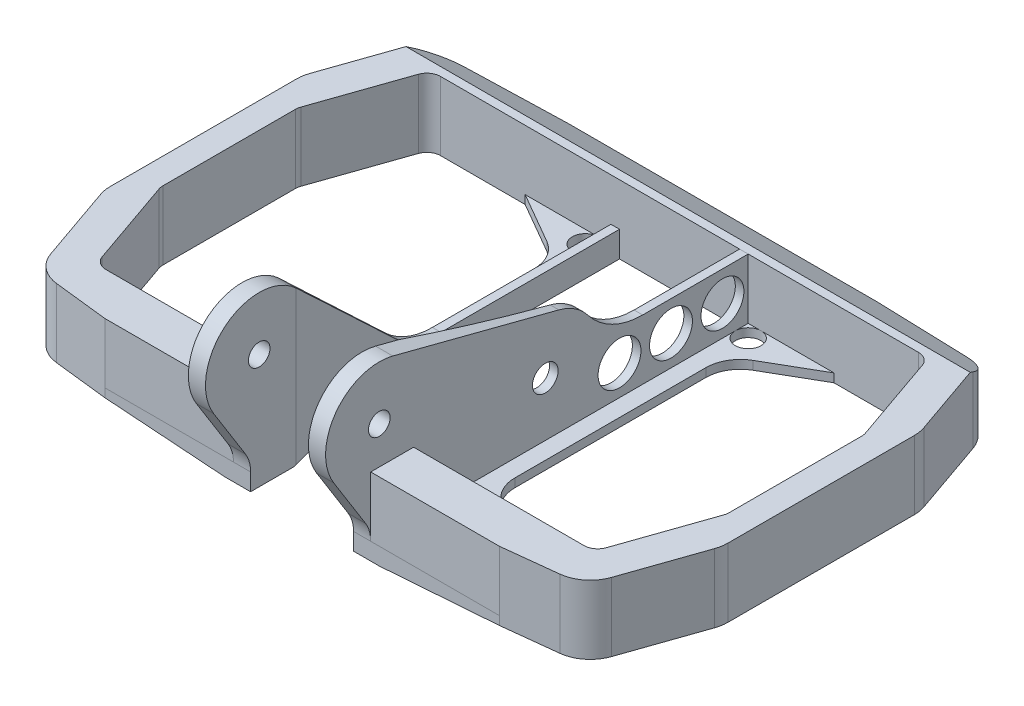
from build123d import *

# Parameters (mm, degrees)
BOSS_EXTRUDE1_DEPTH      = 203.2
BOSS_EXTRUDE1_2_DEPTH    = 203.2
CUT_EXTRUDE2_DEPTH       = 249.300427909
CUT_EXTRUDE2_DEPTH_BACK  = 249.300427909
SKETCH4_R                = 4
CUT_EXTRUDE4_DEPTH       = 18.542
CUT_EXTRUDE4_DEPTH_BACK  = 86.36
SKETCH7_R                = 4
CUT_EXTRUDE3_DEPTH       = 232.284287726
CUT_EXTRUDE3_DEPTH_BACK  = 232.284287726
SKETCH8_R                = 4.7625
CUT_EXTRUDE5_DEPTH       = 210.909001948
FILLET1_R                = 25.4
FILLET2_R                = 25.4
CUT_EXTRUDE7_DEPTH       = 213.960346307
CUT_EXTRUDE7_DEPTH_BACK  = 213.960346307
CUT_EXTRUDE8_DEPTH       = 198.3731504
CUT_EXTRUDE8_DEPTH_BACK  = 198.3731504
BOSS_EXTRUDE2_DEPTH      = 25.4
SKETCH20_W               = 146.05
SKETCH20_H               = 15.875
SKETCH20_W_2             = 34.925
CUT_EXTRUDE14_DEPTH      = 3.175
CUT_EXTRUDE15_DEPTH      = 203.850902078
CUT_EXTRUDE15_DEPTH_BACK = 203.850902078
SKETCH22_R               = 7.9375
CUT_EXTRUDE16_DEPTH      = 3.175
SKETCH23_R               = 7.9375
SKETCH23_R_2             = 4.7625
CUT_EXTRUDE17_DEPTH      = 217.074061086
FILLET3_R                = 5.08
FILLET4_R                = 12.7
FILLET5_R                = 12.7
FILLET6_R                = 12.7


with BuildPart() as part:
    # Sketch1 → Boss-Extrude1 (new body)
    with BuildSketch(Plane.XY):
        Polygon((19.05, 0), (19.05, 76.2), (25.4, 76.2), (25.4, 6.35), (95.25, 6.35), (95.25, 0), align=None)
    extrude(amount=-BOSS_EXTRUDE1_DEPTH)

    # Sketch4 → Cut-Extrude2 (cut, two sides: drawn at the far end of the back side and taken through both)
    with BuildSketch(Plane(origin=(25.4, 0, 0), x_dir=(0, 0, -1), z_dir=(1, 0, 0)).offset(-CUT_EXTRUDE2_DEPTH_BACK)):
        with Locations(Location((22.225, 42.418, 0), (0, 0, 90))):
            Circle(SKETCH4_R)
        with BuildLine():
            Line((17.120481385, 13.079541644), (5.369620667, 31.88653227))
            ThreePointArc((5.369620667, 31.88653227), (6.201730559, 54.176846093), (27.216296973, 61.656050305))
            Line((27.216296973, 61.656050305), (88.681143638, 45.709044332))
            ThreePointArc((88.681143638, 45.709044332), (98.770640841, 39.450451704), (103.534303898, 28.575))
            Line((103.534303898, 28.575), (158.75, 28.575))
            Line((158.75, 28.575), (158.75, 6.35))
            Line((158.75, 6.35), (203.2, 6.35))
            Line((203.2, 6.35), (203.2, 76.2))
            Line((203.2, 76.2), (0, 76.2))
            Line((0, 76.2), (0, 0))
            Line((0, 0), (19.05, 0))
            Line((19.05, 0), (19.05, 6.35))
            ThreePointArc((19.05, 6.35), (18.558093905, 9.850349012), (17.120481385, 13.079541644))
        make_face()
    extrude(amount=CUT_EXTRUDE2_DEPTH + CUT_EXTRUDE2_DEPTH_BACK, mode=Mode.SUBTRACT)


with BuildPart() as body_2:
    # Sketch1 → Boss-Extrude1 2 (new body)
    with BuildSketch(Plane.XY):
        Polygon((-19.05, 76.2), (-19.05, 0), (-95.25, 0), (-95.25, 6.35), (-25.4, 6.35), (-25.4, 76.2), align=None)
    extrude(amount=-BOSS_EXTRUDE1_2_DEPTH)

    # Sketch7 → Cut-Extrude4 (cut, two sides: drawn at the far end of the back side and taken through both)
    with BuildSketch(Plane(origin=(-19.05, 0, 0), x_dir=(0, 0, -1), z_dir=(1, 0, 0)).offset(-CUT_EXTRUDE4_DEPTH_BACK)):
        with Locations(Location((22.225, 42.418, 0), (0, 0, 270))):
            Circle(SKETCH7_R)
        with BuildLine():
            Line((17.120481385, 13.079541644), (5.369620667, 31.88653227))
            ThreePointArc((5.369620667, 31.88653227), (9.63911382, 57.800168055), (35.885087558, 56.854676658))
            Line((35.885087558, 56.854676658), (82.55, 12.7))
            Line((82.55, 12.7), (158.75, 12.7))
            Line((158.75, 12.7), (158.75, 6.35))
            Line((158.75, 6.35), (203.2, 6.35))
            Line((203.2, 6.35), (203.2, 76.2))
            Line((203.2, 76.2), (0, 76.2))
            Line((0, 76.2), (0, 0))
            Line((0, 0), (19.05, 0))
            Line((19.05, 0), (19.05, 6.35))
            ThreePointArc((19.05, 6.35), (18.558093905, 9.850349012), (17.120481385, 13.079541644))
        make_face()
    extrude(amount=CUT_EXTRUDE4_DEPTH + CUT_EXTRUDE4_DEPTH_BACK, mode=Mode.SUBTRACT)


with BuildPart() as cut_extrude3_tool:
    # Sketch6 → Cut-Extrude3 (new, two sides: drawn at the far end of the back side and taken through both)
    with BuildSketch(Plane(origin=(0, 6.35, 0), x_dir=(1, 0, 0), z_dir=(0, 1, 0)).offset(-CUT_EXTRUDE3_DEPTH_BACK)):
        Polygon((73.025, 19.05), (73.025, 34.925), (31.75, 58.755132361), (31.75, 144.085303163), (57.15, 158.75), (57.15, 174.625), (19.05, 174.625), (19.05, 203.2), (95.25, 203.2), (95.25, 19.05), align=None)
        Polygon((-95.25, 19.05), (-73.025, 19.05), (-73.025, 34.925), (-31.75, 58.755132361), (-31.75, 144.085303163), (-57.15, 158.75), (-57.15, 174.625), (-19.05, 174.625), (-19.05, 203.2), (-95.25, 203.2), align=None)
    extrude(amount=CUT_EXTRUDE3_DEPTH + CUT_EXTRUDE3_DEPTH_BACK)


with BuildPart() as part_1:
    add(part.part)

    # Cut-Extrude3: cut by cut_extrude3_tool
    add(cut_extrude3_tool.part, mode=Mode.SUBTRACT)

    # Sketch8 → Cut-Extrude5 (cut, through all)
    with BuildSketch(Plane(origin=(25.4, 0, 0), x_dir=(0, 0, -1), z_dir=(1, 0, 0))):
        with Locations(Location((83.65845486, 26.35, 0), (0, 0, 90))):
            Circle(SKETCH8_R)
    extrude(amount=-CUT_EXTRUDE5_DEPTH, mode=Mode.SUBTRACT)

    # Fillet1
    fillet1_edges = [part_1.edges().sort_by_distance(p)[0] for p in [
        (22.225, 28.575, -103.534303898),
    ]]
    fillet(fillet1_edges, radius=FILLET1_R)


with BuildPart() as body_2_1:
    add(body_2.part)

    # Cut-Extrude3: cut by cut_extrude3_tool
    add(cut_extrude3_tool.part, mode=Mode.SUBTRACT)

    # Fillet2
    fillet2_edges = [body_2_1.edges().sort_by_distance(p)[0] for p in [
        (-22.225, 12.7, -82.55),
    ]]
    fillet(fillet2_edges, radius=FILLET2_R)


with BuildPart() as cut_extrude7_tool:
    # Sketch11 → Cut-Extrude7 (new, two sides: drawn at the far end of the back side and taken through both)
    with BuildSketch(Plane(origin=(31.75, 0, 0), x_dir=(0, 0, -1), z_dir=(1, 0, 0)).offset(-CUT_EXTRUDE7_DEPTH_BACK)):
        with BuildLine():
            Line((548.897499917, 3.175), (174.625, 3.175))
            Line((174.625, 3.175), (58.755132361, 3.175))
            ThreePointArc((58.755132361, 3.175), (46.734776362, 2.377758364), (34.925, 0))
            Line((34.925, 0), (-326.291482478, -97.992637378))
            Line((-326.291482478, -97.992637378), (-240.335656251, -841.586083231))
            Line((-240.335656251, -841.586083231), (634.853326145, -740.418445853))
            Line((634.853326145, -740.418445853), (548.897499917, 3.175))
        make_face()
    extrude(amount=CUT_EXTRUDE7_DEPTH + CUT_EXTRUDE7_DEPTH_BACK)


with BuildPart() as part_2:
    add(part_1.part)

    # Cut-Extrude7: cut by cut_extrude7_tool
    add(cut_extrude7_tool.part, mode=Mode.SUBTRACT)


with BuildPart() as body_2_2:
    add(body_2_1.part)

    # Cut-Extrude7: cut by cut_extrude7_tool
    add(cut_extrude7_tool.part, mode=Mode.SUBTRACT)


with BuildPart() as cut_extrude8_tool:
    # Sketch13 → Cut-Extrude8 (new, two sides: drawn at the far end of the back side and taken through both)
    with BuildSketch(Plane(origin=(0, 6.35, 0), x_dir=(1, 0, 0), z_dir=(0, 1, 0)).offset(-CUT_EXTRUDE8_DEPTH_BACK)):
        with BuildLine():
            Line((-22.225, 174.625), (-22.225, 92.662190885))
            ThreePointArc((-22.225, 92.662190885), (-21.430630436, 64.229287027), (-19.05, 35.885087558))
            Line((-19.05, 35.885087558), (19.05, 35.885087558))
            ThreePointArc((19.05, 35.885087558), (21.430630436, 64.229287027), (22.225, 92.662190885))
            Line((22.225, 92.662190885), (22.225, 174.625))
            Line((22.225, 174.625), (-22.225, 174.625))
        make_face()
    extrude(amount=CUT_EXTRUDE8_DEPTH + CUT_EXTRUDE8_DEPTH_BACK)


with BuildPart() as part_3:
    add(part_2.part)

    # Cut-Extrude8: cut by cut_extrude8_tool
    add(cut_extrude8_tool.part, mode=Mode.SUBTRACT)


with BuildPart() as body_2_3:
    add(body_2_2.part)

    # Cut-Extrude8: cut by cut_extrude8_tool
    add(cut_extrude8_tool.part, mode=Mode.SUBTRACT)


with BuildPart() as body_3:
    # Sketch19 → Boss-Extrude2 (new body)
    with BuildSketch(Plane.XZ.offset(-3.175)):
        Polygon((-57.15, -174.625), (57.15, -174.625), (101.103922166, -171.45), (114.3, -133.511276226), (114.3, -60.163723774), (101.103922166, -22.225), (73.025, -19.05), (25.4, -19.05), (25.4, -34.925), (92.075, -34.925), (104.775, -71.4375), (104.775, -122.2375), (92.075, -158.75), (-92.075, -158.75), (-104.775, -122.2375), (-104.775, -71.4375), (-92.075, -34.925), (-25.4, -34.925), (-25.4, -19.05), (-73.025, -19.05), (-101.103922166, -22.225), (-114.3, -60.163723774), (-114.3, -133.511276226), (-101.103922166, -171.45), align=None)
    extrude(amount=-BOSS_EXTRUDE2_DEPTH)

    # Sketch20 → Cut-Extrude14 (cut)
    with BuildSketch(Plane.XZ.offset(-3.175)):
        with Locations((0, -26.9875)):
            Rectangle(SKETCH20_W, SKETCH20_H)
        with Locations((39.6875, -166.6875)):
            Rectangle(SKETCH20_W_2, SKETCH20_H)
        with Locations((-39.6875, -166.6875)):
            Rectangle(SKETCH20_W_2, SKETCH20_H)
    extrude(amount=-CUT_EXTRUDE14_DEPTH, mode=Mode.SUBTRACT)

    # Chamfer1
    # the kernel refuses this chamfer: 12.7, 7.332348419 mm, written as the material it takes off along each edge
    with BuildSketch(Plane(origin=(-136.004373802, 28.575, -174.625), x_dir=(0, -0.9983227437537927, -0.057893862402669395), z_dir=(1, 0, 0))) as chamfer1_piece_1:
        with BuildLine():
            Line((7.599094047, 0), (-1.014295908, -13.103196816))
            Line((-1.014295908, -13.103196816), (-1.267869885, -13.088491775))
            ThreePointArc((-1.267869885, -13.088491775), (-0.633934942, -6.544245888), (-0.253573977, 0.014705041))
            Line((-0.253573977, 0.014705041), (0.014705041, 0.253573977))
            ThreePointArc((0.014705041, 0.253573977), (3.801517125, 0.033972471), (7.613799088, 0.253573977))
            Line((7.613799088, 0.253573977), (7.599094047, 0))
        make_face()
    extrude(amount=272.008747603, mode=Mode.SUBTRACT)

    # Fillet3
    fillet3_edges = [body_3.edges().sort_by_distance(p)[0] for p in [
        (-92.075, 15.875, -34.925),
        (-104.775, 15.875, -71.4375),
        (-104.775, 15.875, -122.2375),
        (-92.075, 15.875, -158.75),
        (92.075, 15.875, -158.75),
        (104.775, 15.875, -122.2375),
        (104.775, 15.875, -71.4375),
        (92.075, 15.875, -34.925),
    ]]
    fillet(fillet3_edges, radius=FILLET3_R)

    # Fillet4
    fillet4_edges = [body_3.edges().sort_by_distance(p)[0] for p in [
        (101.103922166, 13.125369343, -171.45),
        (-101.103922166, 13.125369343, -171.45),
        (-114.3, 15.875, -60.163723774),
        (-101.103922166, 15.875, -22.225),
        (101.103922166, 15.875, -22.225),
        (114.3, 15.875, -60.163723774),
        (114.3, 15.875, -133.511276226),
        (-114.3, 15.875, -133.511276226),
    ]]
    fillet(fillet4_edges, radius=FILLET4_R)


with BuildPart() as cut_extrude15_tool:
    # Sketch21 → Cut-Extrude15 (new, two sides: drawn at the far end of the back side and taken through both)
    with BuildSketch(Plane.XY.offset(-19.05).offset(-CUT_EXTRUDE15_DEPTH_BACK)):
        Polygon((73.025, 3.175), (28.575, 0), (-28.575, 0), (-73.025, 3.175), (-73.025, -19.740054261), (73.025, -19.740054261), align=None)
    extrude(amount=CUT_EXTRUDE15_DEPTH + CUT_EXTRUDE15_DEPTH_BACK)


with BuildPart() as part_4:
    add(part_3.part)

    # Cut-Extrude15: cut by cut_extrude15_tool
    add(cut_extrude15_tool.part, mode=Mode.SUBTRACT)

    # Sketch22 → Cut-Extrude16 (cut)
    with BuildSketch(Plane(origin=(25.4, 0, 0), x_dir=(0, 0, -1), z_dir=(1, 0, 0))):
        with Locations(Location((149.225, 17.4625, 0), (0, 0, 90))):
            Circle(SKETCH22_R)
        with Locations(Location((130.175, 17.4625, 0), (0, 0, 90))):
            Circle(SKETCH22_R)
        with Locations(Location((111.125, 17.4625, 0), (0, 0, 90))):
            Circle(SKETCH22_R)
    extrude(amount=-CUT_EXTRUDE16_DEPTH, mode=Mode.SUBTRACT)


with BuildPart() as body_2_4:
    add(body_2_3.part)

    # Cut-Extrude15: cut by cut_extrude15_tool
    add(cut_extrude15_tool.part, mode=Mode.SUBTRACT)


with BuildPart() as cut_extrude17_tool:
    # Sketch23 → Cut-Extrude17 (new, through all)
    with BuildSketch(Plane(origin=(0, 6.35, 0), x_dir=(1, 0, 0), z_dir=(0, 1, 0))):
        with Locations(Location((33.3375, 42.8625, 0), (0, 0, 180))):
            Circle(SKETCH23_R)
        with Locations(Location((48.424420657, 39.6875, 0), (0, 0, 180))):
            Circle(SKETCH23_R_2)
        with Locations(Location((-48.424420657, 39.6875, 0), (0, 0, 145.032086849))):
            Circle(SKETCH23_R_2)
        with Locations(Location((-33.3375, 42.8625, 0), (0, 0, 217.200401593))):
            Circle(SKETCH23_R)
        with Locations(Location((30.1625, 153.9875, 0), (0, 0, 180))):
            Circle(SKETCH23_R_2)
        with Locations((-30.1625, 153.9875)):
            Circle(SKETCH23_R_2)
    extrude(amount=-CUT_EXTRUDE17_DEPTH)


with BuildPart() as part_5:
    add(part_4.part)

    # Cut-Extrude17: cut by cut_extrude17_tool
    add(cut_extrude17_tool.part, mode=Mode.SUBTRACT)

    # Fillet5
    fillet5_edges = [part_5.edges().sort_by_distance(p)[0] for p in [
        (31.75, 4.7625, -144.085303163),
        (31.75, 4.7625, -58.755132361),
    ]]
    fillet(fillet5_edges, radius=FILLET5_R)


with BuildPart() as body_2_5:
    add(body_2_4.part)

    # Cut-Extrude17: cut by cut_extrude17_tool
    add(cut_extrude17_tool.part, mode=Mode.SUBTRACT)

    # Fillet6
    fillet6_edges = [body_2_5.edges().sort_by_distance(p)[0] for p in [
        (-31.75, 4.7625, -58.755132361),
        (-31.75, 4.7625, -144.085303163),
    ]]
    fillet(fillet6_edges, radius=FILLET6_R)


solid = Compound([body_3.part, part_5.part, body_2_5.part])
